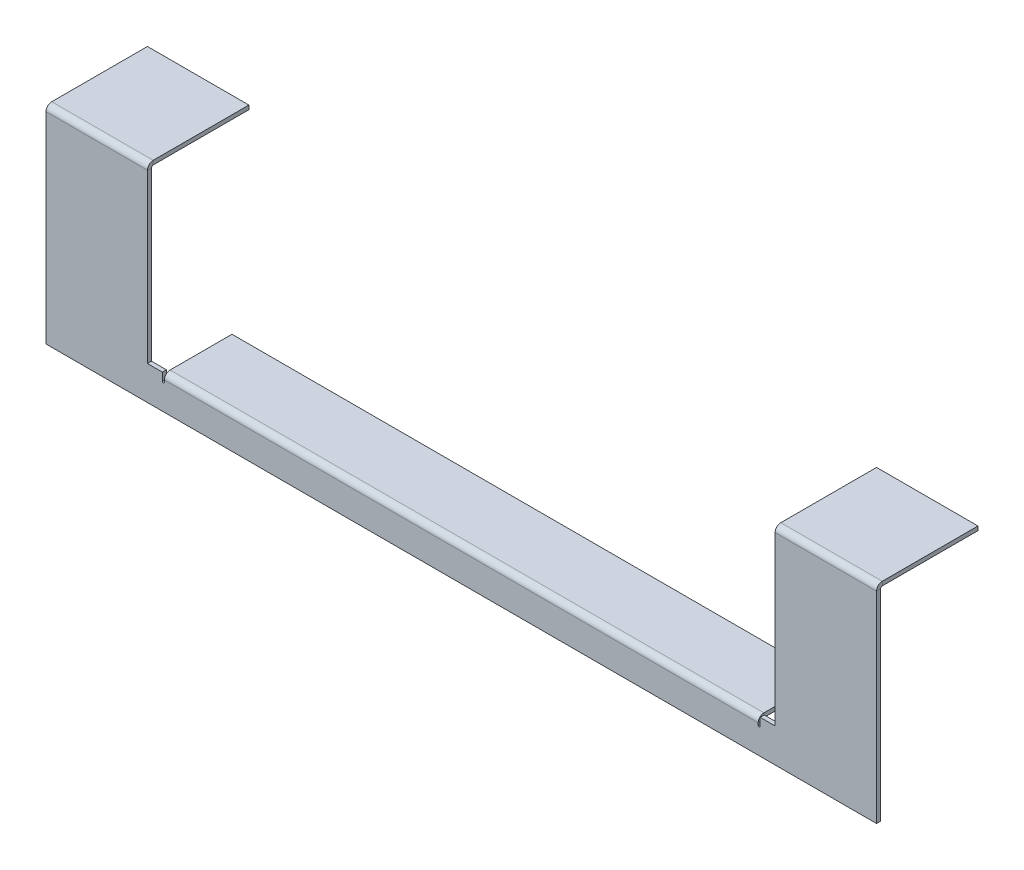
from build123d import *

# Parameters (mm, degrees)
SKETCH_2_W                         = 245.6
SKETCH_2_H                         = 61.2
SM_BASE_FLANGE_1_DEPTH             = 1.2
SKETCH_8_W                         = 185.6
SKETCH_8_H                         = 51.2
CUT_EXTRUDE_1_DEPTH                = 10
SM_EDGE_FLANGE_1_STRIP_W           = 5.8
SM_EDGE_FLANGE_1_STRIP_H           = 1.2
SM_EDGE_FLANGE_1_STRIP_CUT_DEPTH   = 30
SM_EDGE_FLANGE_1_STRIP_2_W         = 5.8
SM_EDGE_FLANGE_1_STRIP_2_H         = 1.2
SM_EDGE_FLANGE_1_STRIP_CUT_2_DEPTH = 30
SM_EDGE_FLANGE_1_DEPTH             = 30
SM_EDGE_FLANGE_1_BEND_DEPTH        = 30
SM_START                           = -1.7
SM_EDGE_FLANGE_2_DEPTH             = 2.7
SM_START_2                         = -20
SM_EDGE_FLANGE_2_2_OUTLINE_W       = 175.6
SM_EDGE_FLANGE_2_2_OUTLINE_H       = 1.2
SM_EDGE_FLANGE_2_2_DEPTH           = 18.3
SM_START_3                         = -87.8
SM_EDGE_FLANGE_2_3_DEPTH           = 175.6
SM_EDGE_FLANGE_2_4_DEPTH           = 175.6


with BuildPart() as part:
    # 基体-法兰1: sheet metal written as solids
    # Sketch 2 → 基体-法兰1 (new body)
    with BuildSketch(Plane.XY):
        Rectangle(SKETCH_2_W, SKETCH_2_H)
    extrude(amount=-SM_BASE_FLANGE_1_DEPTH)

    # 草图8 → 切除-拉伸1 (cut)
    with BuildSketch(Plane.XY):
        with Locations((0, 5)):
            Rectangle(SKETCH_8_W, SKETCH_8_H)
    extrude(amount=-CUT_EXTRUDE_1_DEPTH, mode=Mode.SUBTRACT)

    # 边线-法兰1: sheet metal written as solids
    # 边线-法兰1 strip (on a plane across the edge) → 边线-法兰1 strip cut (cut)
    with BuildSketch(Plane(origin=(92.8, 30.6, -1.2), x_dir=(0, -1, 0), z_dir=(1, 0, 0))):
        with Locations((-1.2, -0.6)):
            Rectangle(SM_EDGE_FLANGE_1_STRIP_W, SM_EDGE_FLANGE_1_STRIP_H)
    extrude(amount=SM_EDGE_FLANGE_1_STRIP_CUT_DEPTH, mode=Mode.SUBTRACT)

    # 边线-法兰1 strip 2 (on a plane across the edge) → 边线-法兰1 strip cut 2 (cut)
    with BuildSketch(Plane(origin=(-122.8, 30.6, -1.2), x_dir=(0, -1, 0), z_dir=(1, 0, 0))):
        with Locations((-1.2, -0.6)):
            Rectangle(SM_EDGE_FLANGE_1_STRIP_2_W, SM_EDGE_FLANGE_1_STRIP_2_H)
    extrude(amount=SM_EDGE_FLANGE_1_STRIP_CUT_2_DEPTH, mode=Mode.SUBTRACT)

    # 边线-法兰1 section (on a plane across the edge) → 边线-法兰1 (add)
    with BuildSketch(Plane(origin=(92.8, 30.6, -1.2), x_dir=(0, -1, 0), z_dir=(1, 0, 0))):
        with BuildLine():
            Line((0, 0.5), (0, 28.8))
            Line((0, 28.8), (1.2, 28.8))
            Line((1.2, 28.8), (1.2, 0.5))
            ThreePointArc((1.2, 0.5), (1.346446609, 0.146446609), (1.7, 0))
            Line((1.7, 0), (1.7, -1.2))
            ThreePointArc((1.7, -1.2), (0.497918472, -0.702081528), (0, 0.5))
        make_face()
    extrude(amount=SM_EDGE_FLANGE_1_DEPTH)

    # 边线-法兰1 section 2 (on a plane across the edge) → 边线-法兰1 bend (add)
    with BuildSketch(Plane(origin=(-122.8, 30.6, -1.2), x_dir=(0, -1, 0), z_dir=(1, 0, 0))):
        with BuildLine():
            Line((0, 0.5), (0, 28.8))
            Line((0, 28.8), (1.2, 28.8))
            Line((1.2, 28.8), (1.2, 0.5))
            ThreePointArc((1.2, 0.5), (1.346446609, 0.146446609), (1.7, 0))
            Line((1.7, 0), (1.7, -1.2))
            ThreePointArc((1.7, -1.2), (0.497918472, -0.702081528), (0, 0.5))
        make_face()
    extrude(amount=SM_EDGE_FLANGE_1_BEND_DEPTH)

    # 边线-法兰2: read off the stored shape, not the designer's step
    # 边线-法兰2 outline → 边线-法兰2 (cut)
    with BuildSketch(Plane.XY.offset(SM_START)):
        with BuildLine():
            Line((-87.8, -22.9), (-87.8, -20.6))
            Line((-87.8, -20.6), (-88.4, -20.6))
            Line((-88.4, -20.6), (-88.4, -22.9))
            ThreePointArc((-88.4, -22.9), (-88.1, -23.2), (-87.8, -22.9))
        make_face()
        with BuildLine():
            Line((88.4, -20.6), (87.8, -20.6))
            Line((87.8, -20.6), (87.8, -22.9))
            ThreePointArc((87.8, -22.9), (88.1, -23.2), (88.4, -22.9))
            Line((88.4, -22.9), (88.4, -20.6))
        make_face()
    extrude(amount=SM_EDGE_FLANGE_2_DEPTH, mode=Mode.SUBTRACT)

    # Sm Edge Flange 2 3 outline → Sm Edge Flange 2 3 (cut)
    with BuildSketch(Plane.YZ.offset(SM_START_3)):
        with BuildLine():
            ThreePointArc((-22.3, 0), (-21.290049506, -0.332520567), (-20.675192319, -1.2))
            Line((-20.675192319, -1.2), (-20.6, -1.2))
            Line((-20.6, -1.2), (-20.6, 0))
            Line((-20.6, 0), (-22.3, 0))
        make_face()
    extrude(amount=SM_EDGE_FLANGE_2_3_DEPTH, mode=Mode.SUBTRACT)



with BuildPart() as body_2:
    # Sm Edge Flange 2 2 outline → Sm Edge Flange 2 2 (new body)
    with BuildSketch(Plane.XY.offset(SM_START_2)):
        with Locations((0, -21.2)):
            Rectangle(SM_EDGE_FLANGE_2_2_OUTLINE_W, SM_EDGE_FLANGE_2_2_OUTLINE_H)
    extrude(amount=SM_EDGE_FLANGE_2_2_DEPTH)


with BuildPart() as part_1:
    add(part.part)

    add(body_2.part)  # Sm Edge Flange 2 4 merges body 2
    # Sm Edge Flange 2 4 outline → Sm Edge Flange 2 4 (add)
    with BuildSketch(Plane.YZ.offset(SM_START_3)):
        with BuildLine():
            Line((-21.8, -1.7), (-20.6, -1.7))
            ThreePointArc((-20.6, -1.7), (-20.618903177, -1.447188863), (-20.675192319, -1.2))
            Line((-20.675192319, -1.2), (-22.3, -1.2))
            ThreePointArc((-22.3, -1.2), (-21.946446609, -1.346446609), (-21.8, -1.7))
        make_face()
    extrude(amount=SM_EDGE_FLANGE_2_4_DEPTH)


solid = part_1.part
